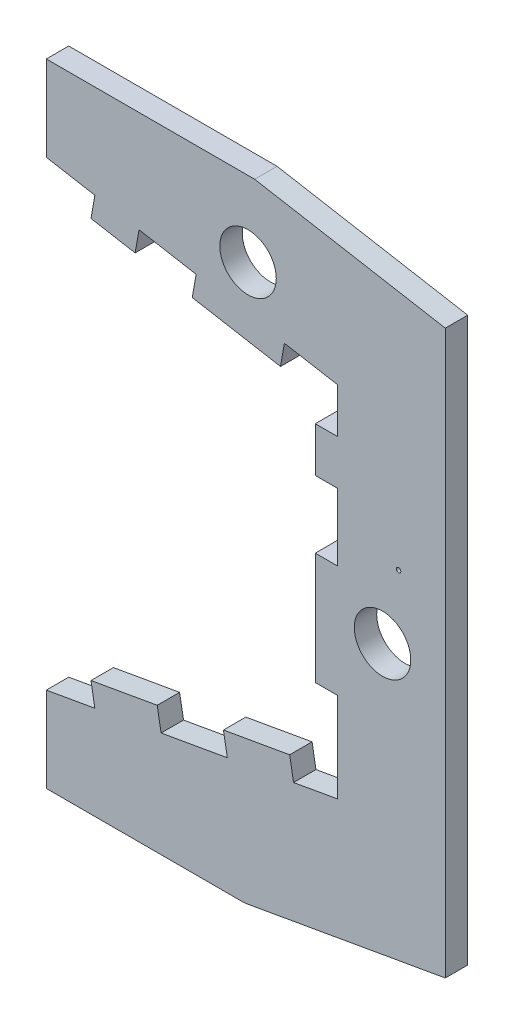
from build123d import *

# Parameters (mm, degrees)
ESQUISSE1_R             = 6.3
ESQUISSE1_R_2           = 0.5
BOSS_EXTRU_1_DEPTH      = 5
ESQUISSE4_W             = 5
ESQUISSE4_H             = 25
ESQUISSE4_H_2           = 10
BOSS_EXTRU_2_DEPTH      = 5
ENL_V_MAT_EXTRU_1_DEPTH = 5


with BuildPart() as part:
    # Esquisse1 → Boss.-Extru.1 (new body)
    with BuildSketch(Plane.XY):
        Polygon((-65, 51.461253746), (0, 40), (0, -40), (-65, -51.461253746), (-65, -71.461253746), (-20.625899742, -71.461253746), (25, -63.416176602), (25, 63.800831685), (-18.444412366, 71.461253746), (-65, 71.461253746), align=None)
        with Locations((-20, 53.680805733)):
            Circle(ESQUISSE1_R, mode=Mode.SUBTRACT)
        with Locations((10, -5)):
            Circle(ESQUISSE1_R, mode=Mode.SUBTRACT)
        with Locations((13.572008954, 11)):
            Circle(ESQUISSE1_R_2, mode=Mode.SUBTRACT)
    extrude(amount=BOSS_EXTRU_1_DEPTH)

    # Esquisse4 → Boss.-Extru.2 (add)
    with BuildSketch(Plane.XY.offset(5)):
        with Locations((-2.5, -7.5)):
            Rectangle(ESQUISSE4_W, ESQUISSE4_H)
        Polygon((-11.888404247, 42.096246426), (-31.584559307, 45.56920998), (-32.452800195, 40.645171215), (-12.756645135, 37.172207661), align=None)
        Polygon((-9.84807753, -41.736481777), (-24.620193825, -44.341204442), (-25.488434714, -39.417165677), (-10.716318418, -36.812443012), align=None)
        with Locations((-2.5, 25)):
            Rectangle(ESQUISSE4_W, ESQUISSE4_H_2)
        Polygon((-54.164426416, -49.550649772), (-39.39231012, -46.945927107), (-40.260551009, -42.021888342), (-55.032667304, -44.626611007), align=None)
        Polygon((-44.316348886, 47.814167995), (-54.164426416, 49.550649772), (-55.032667304, 44.626611007), (-45.184589774, 42.89012923), align=None)
    extrude(amount=-BOSS_EXTRU_2_DEPTH)

    # Esquisse5 → Enlèv. mat.-Extru.1 (cut)
    with BuildSketch(Plane.XY.offset(5)):
        Polygon((-65, 70.461253746), (-18.53190103, 70.461253746), (24, 62.961732054), (24, -62.577076971), (-20.713388405, -70.461253746), (-65, -70.461253746), (-65, -77.148207451), (34.423224657, -77.148207451), (34.423224657, 88.893594993), (-65, 88.893594993), align=None)
    extrude(amount=-ENL_V_MAT_EXTRU_1_DEPTH, mode=Mode.SUBTRACT)


solid = part.part
